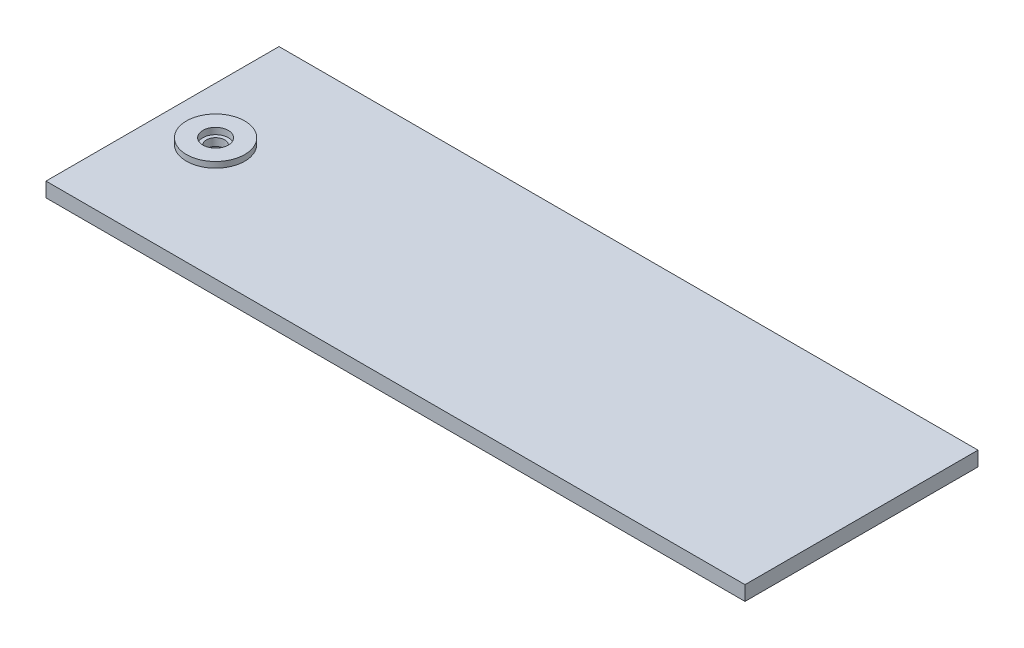
from build123d import *

# Parameters (mm, degrees)
SKETCH1_W           = 609.6
SKETCH1_H           = 203.2
BOSS_EXTRUDE1_DEPTH = 12.7
SKETCH2_R           = 25.4
BOSS_EXTRUDE3_DEPTH = 5.08
SKETCH9_R           = 11.1125
CUT_EXTRUDE4_DEPTH  = 5.55625
CUT_EXTRUDE5_START  = -5.55625
SKETCH10_R          = 11.1125
CUT_EXTRUDE5_DEPTH  = 5.55625
SKETCH11_R          = 7.9375
CUT_EXTRUDE6_DEPTH  = 322.519859517


with BuildPart() as part:
    # Sketch1 → Boss-Extrude1 (new body)
    with BuildSketch(Plane(origin=(0, 0, 0), x_dir=(1, 0, 0), z_dir=(0, 1, 0))):
        Rectangle(SKETCH1_W, SKETCH1_H)
    extrude(amount=BOSS_EXTRUDE1_DEPTH)

    # Sketch2 → Boss-Extrude3 (add)
    with BuildSketch(Plane(origin=(0, 12.7, 0), x_dir=(1, 0, 0), z_dir=(0, 1, 0))):
        with Locations((-258.510557857, 0)):
            Circle(SKETCH2_R)
    extrude(amount=BOSS_EXTRUDE3_DEPTH)

    # Sketch9 → Cut-Extrude4 (cut)
    with BuildSketch(Plane(origin=(0, 17.78, 0), x_dir=(1, 0, 0), z_dir=(0, 1, 0))):
        with Locations((-258.510557857, 0)):
            Circle(SKETCH9_R)
    extrude(amount=-CUT_EXTRUDE4_DEPTH, mode=Mode.SUBTRACT)

    # Sketch10 → Cut-Extrude5 (cut)
    with BuildSketch(Plane(origin=(0, 0, 0), x_dir=(-1, 0, 0), z_dir=(0, -1, 0)).offset(CUT_EXTRUDE5_START)):
        with Locations((258.510557857, 0)):
            Circle(SKETCH10_R)
    extrude(amount=CUT_EXTRUDE5_DEPTH, mode=Mode.SUBTRACT)

    # Sketch11 → Cut-Extrude6 (cut, through all)
    with BuildSketch(Plane(origin=(0, 12.22375, 0), x_dir=(1, 0, 0), z_dir=(0, 1, 0))):
        with Locations((-258.510557857, 0)):
            Circle(SKETCH11_R)
    extrude(amount=-CUT_EXTRUDE6_DEPTH, mode=Mode.SUBTRACT)


solid = part.part
